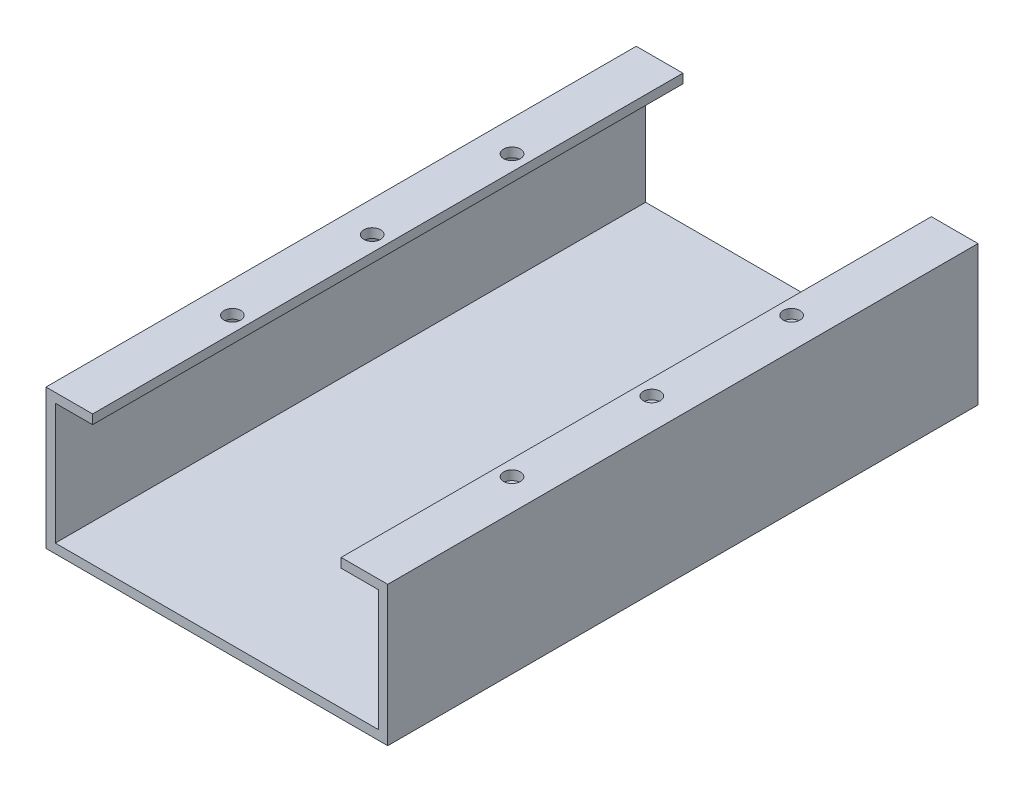
from build123d import *

# Parameters (mm, degrees)
EXTRUDE_1_DEPTH        = 110
SKETCH_2_R             = 2.7
CUT_EXTRUDE_1_DEPTH    = 3
EXTRUDE_2_DEPTH        = 40
PATTERN_LINEAR_1_COUNT = 2
PATTERN_LINEAR_1_PITCH = 150


with BuildPart() as part:
    # 草图1 → 凸台-拉伸1 (new body)
    with BuildSketch(Plane.XY):
        Polygon((0, -10), (110, -10), (110, 35), (95, 35), (95, 32), (107, 32), (107, -7), (3, -7), (3, 32), (15, 32), (15, 35), (0, 35), align=None)
    extrude(amount=EXTRUDE_1_DEPTH)

    # 草图2 → 切除-拉伸1 (cut)
    with BuildSketch(Plane(origin=(0, 35, 0), x_dir=(1, 0, 0), z_dir=(0, 1, 0))):
        with Locations((10, -10)):
            Circle(SKETCH_2_R)
        with Locations((100, -10)):
            Circle(SKETCH_2_R)
        with Locations((100, -55)):
            Circle(SKETCH_2_R)
        with Locations((100, -100)):
            Circle(SKETCH_2_R)
        with Locations((10, -55)):
            Circle(SKETCH_2_R)
        with Locations((10, -100)):
            Circle(SKETCH_2_R)
    extrude(amount=-CUT_EXTRUDE_1_DEPTH, mode=Mode.SUBTRACT)

    # 草图3 → 凸台-拉伸2 (add)
    with BuildSketch(Plane.XY.offset(110)):
        Polygon((15, 32), (15, 35), (0, 35), (0, -10), (110, -10), (110, 35), (95, 35), (95, 32), (107, 32), (107, -7), (3, -7), (3, 32), align=None)
    extrude_2 = extrude(amount=EXTRUDE_2_DEPTH)

    # 阵列(线性)1: 凸台-拉伸2 ×2
    with Locations(*[(0, 0, -i * PATTERN_LINEAR_1_PITCH) for i in range(1, PATTERN_LINEAR_1_COUNT)]):
        add(extrude_2)


solid = part.part
